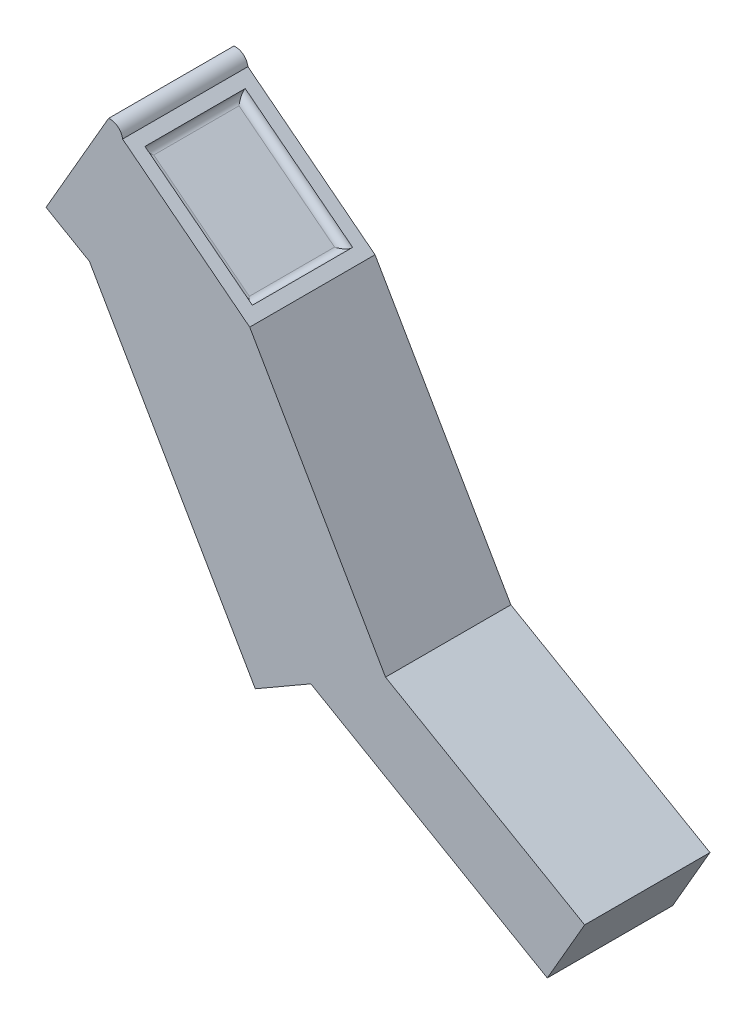
from build123d import *

# Parameters (mm, degrees)
EXTRUDE_1_DEPTH     = 5
SKETCH_2_W          = 5.436001784
SKETCH_2_H          = 4
CUT_EXTRUDE_1_DEPTH = 0.3
FILLET_2_R          = 0.3
EXTRUDE_2_DEPTH     = 5


with BuildPart() as part:
    # 草图1 → 凸台-拉伸1 (new body)
    with BuildSketch(Plane.XY):
        with BuildLine():
            Line((-6.127180226, -2.201181898), (-3.631722259, 2.12107809))
            ThreePointArc((-3.631722259, 2.12107809), (-3.262353303, 2.018731118), (-3.073540248, 1.685177587))
            Line((-3.073540248, 1.685177587), (1.998975947, -2.27609726))
            Line((1.998975947, -2.27609726), (6.288373272, -9.705551361))
            Line((6.288373272, -9.705551361), (7.418073814, -11.662250097))
            Line((7.418073814, -11.662250097), (2.221921391, -14.662250097))
            Line((2.221921391, -14.662250097), (-4.395129419, -3.201181898))
            Line((-4.395129419, -3.201181898), (-6.127180226, -2.201181898))
        make_face()
    extrude(amount=EXTRUDE_1_DEPTH)

    # 草图2 → 切除-拉伸1 (cut)
    with BuildSketch(Plane(origin=(-0.346861308, -0.444164989, 0), x_dir=(0.7881471083112889, -0.6154869094144516, 0), z_dir=(0.6154869094144517, 0.788147108311289, 0))):
        with Locations((-0.241605711, -2.5)):
            Rectangle(SKETCH_2_W, SKETCH_2_H)
    extrude(amount=-CUT_EXTRUDE_1_DEPTH, mode=Mode.SUBTRACT)

    # 圆角2
    fillet_2_edges = [part.edges().sort_by_distance(p)[0] for p in [
        (-2.864112767, 1.14099, 2.5),
        (-0.721928223, -0.531903969, 0.5),
        (1.42025632, -2.204797938, 2.5),
        (-0.721928223, -0.531903969, 4.5),
    ]]
    fillet(fillet_2_edges, radius=FILLET_2_R - 0.0001)  # a hair under: the kernel refuses the full size

    # 草图3 → 凸台-拉伸2 (add)
    with BuildSketch(Plane.XY.offset(5)):
        Polygon((7.418073814, -11.662250097), (15.362099483, -16.248735455), (13.872535789, -18.828735455), (4.438946425, -13.382250097), align=None)
    extrude(amount=-EXTRUDE_2_DEPTH)


solid = part.part
